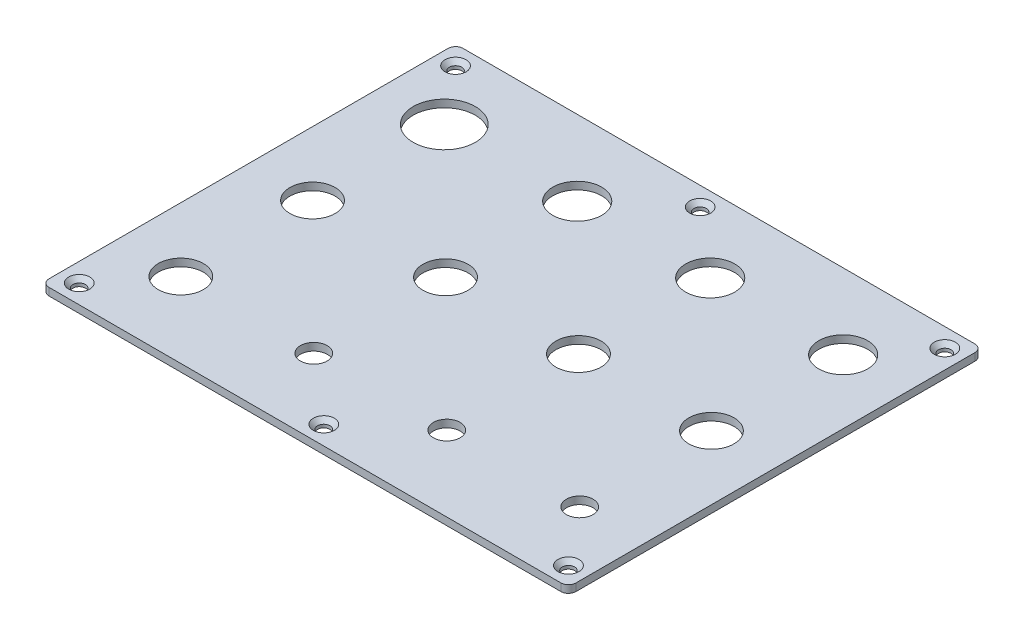
from build123d import *

# Parameters (mm, degrees)
BOTTOM_PLATE_W                       = 140
BOTTOM_PLATE_H                       = 110
BOTTOM_PLATE_EXT_DEPTH               = 2
MIDDLE_ROW_R                         = 6
MIDDLE_ROW_CUT_DEPTH                 = 179.056170912
TOP_ROW_R                            = 8.25
TOP_ROW_R_2                          = 6.5
TOP_ROW_CUT_DEPTH                    = 179.056170912
BOTTOM_ROW_R                         = 3.55
BOTTOM_ROW_R_2                       = 6
BOTTOM_ROW_CUT_DEPTH                 = 179.056170912
PLATE_SCREWS_R                       = 1.65
PLATE_SCREWS_CUT_DEPTH               = 179.056170912
PLATE_SCREW_HEAD_R                   = 2.8
PLATE_SCREW_HEAD_CUT_DEPTH           = 2
PLATE_SCREW_HEAD_CUT_DRAFT           = -45
PLATE_SCREW_HEAD_CUT_PROFILE_2_DEPTH = 2
PLATE_SCREW_HEAD_CUT_PROFILE_2_DRAFT = -45
PLATE_SCREW_HEAD_CUT_PROFILE_3_DEPTH = 2
PLATE_SCREW_HEAD_CUT_PROFILE_3_DRAFT = -45
PLATE_SCREW_HEAD_CUT_PROFILE_4_DEPTH = 2
PLATE_SCREW_HEAD_CUT_PROFILE_4_DRAFT = -45
PLATE_SCREW_HEAD_CUT_PROFILE_5_DEPTH = 2
PLATE_SCREW_HEAD_CUT_PROFILE_5_DRAFT = -45
PLATE_SCREW_HEAD_CUT_PROFILE_6_DEPTH = 2
PLATE_SCREW_HEAD_CUT_PROFILE_6_DRAFT = -45
FILLET1_R                            = 2
FILLET2_R                            = 2
FILLET3_R                            = 2
FILLET4_R                            = 2


with BuildPart() as part:
    # Bottom Plate → Bottom Plate EXT (new body)
    with BuildSketch(Plane(origin=(0, 0, 0), x_dir=(1, 0, 0), z_dir=(0, 1, 0))):
        with Locations((-70, 55)):
            Rectangle(BOTTOM_PLATE_W, BOTTOM_PLATE_H)
    extrude(amount=BOTTOM_PLATE_EXT_DEPTH)

    # Middle Row → Middle Row Cut (cut, through all)
    with BuildSketch(Plane(origin=(0, 2, 0), x_dir=(1, 0, 0), z_dir=(0, 1, 0))):
        with Locations((-123, 55)):
            Circle(MIDDLE_ROW_R)
        with Locations((-87.666666667, 55)):
            Circle(MIDDLE_ROW_R)
        with Locations((-52.333333333, 55)):
            Circle(MIDDLE_ROW_R)
        with Locations((-17, 55)):
            Circle(MIDDLE_ROW_R)
    extrude(amount=-MIDDLE_ROW_CUT_DEPTH, mode=Mode.SUBTRACT)

    # Top Row → Top Row Cut (cut, through all)
    with BuildSketch(Plane(origin=(0, 2, 0), x_dir=(1, 0, 0), z_dir=(0, 1, 0))):
        with Locations((-123, 90)):
            Circle(TOP_ROW_R)
        with Locations((-87.666666667, 90)):
            Circle(TOP_ROW_R_2)
        with Locations((-52.333333333, 90)):
            Circle(TOP_ROW_R_2)
        with Locations((-17, 90)):
            Circle(TOP_ROW_R_2)
    extrude(amount=-TOP_ROW_CUT_DEPTH, mode=Mode.SUBTRACT)

    # Bottom Row → Bottom Row Cut (cut, through all)
    with BuildSketch(Plane(origin=(0, 2, 0), x_dir=(1, 0, 0), z_dir=(0, 1, 0))):
        with Locations((-87.666666667, 20)):
            Circle(BOTTOM_ROW_R)
        with Locations((-52.333333333, 20)):
            Circle(BOTTOM_ROW_R)
        with Locations((-17, 20)):
            Circle(BOTTOM_ROW_R)
        with Locations((-123, 20)):
            Circle(BOTTOM_ROW_R_2)
    extrude(amount=-BOTTOM_ROW_CUT_DEPTH, mode=Mode.SUBTRACT)

    # Plate Screws → Plate Screws Cut (cut, through all)
    with BuildSketch(Plane(origin=(0, 2, 0), x_dir=(1, 0, 0), z_dir=(0, 1, 0))):
        with Locations((-135, 105)):
            Circle(PLATE_SCREWS_R)
        with Locations((-5, 105)):
            Circle(PLATE_SCREWS_R)
        with Locations((-5, 5)):
            Circle(PLATE_SCREWS_R)
        with Locations((-135, 5)):
            Circle(PLATE_SCREWS_R)
        with Locations((-70, 105)):
            Circle(PLATE_SCREWS_R)
        with Locations((-70, 5)):
            Circle(PLATE_SCREWS_R)
    extrude(amount=-PLATE_SCREWS_CUT_DEPTH, mode=Mode.SUBTRACT)


with BuildPart() as plate_screw_head_cut_tool:
    # Plate Screw Head → Plate Screw Head Cut (with draft: the straight prism first)
    with BuildSketch(Plane(origin=(0, 2, 0), x_dir=(1, 0, 0), z_dir=(0, 1, 0))):
        with Locations((-135, 105)):
            Circle(PLATE_SCREW_HEAD_R)
    extrude(amount=-PLATE_SCREW_HEAD_CUT_DEPTH)
    # Plate Screw Head Cut: the draft: its side faces are tilted about the plane it starts from
    plate_screw_head_cut_sides = [plate_screw_head_cut_tool.faces().sort_by_distance(p)[0] for p in [
        (-137.8, 1, -105),
    ]]
    draft(plate_screw_head_cut_sides, Plane(origin=(0, 2, 0), x_dir=(1, 0, 0), z_dir=(0, 1, 0)), PLATE_SCREW_HEAD_CUT_DRAFT)


with BuildPart() as part_1:
    add(part.part)

    # Plate Screw Head Cut: cut by plate_screw_head_cut_tool
    add(plate_screw_head_cut_tool.part, mode=Mode.SUBTRACT)


with BuildPart() as plate_screw_head_cut_profile_2_tool:
    # Plate Screw Head → Plate Screw Head Cut profile 2 (with draft: the straight prism first)
    with BuildSketch(Plane(origin=(0, 2, 0), x_dir=(1, 0, 0), z_dir=(0, 1, 0))):
        with Locations((-5, 105)):
            Circle(PLATE_SCREW_HEAD_R)
    extrude(amount=-PLATE_SCREW_HEAD_CUT_PROFILE_2_DEPTH)
    # Plate Screw Head Cut profile 2: the draft: its side faces are tilted about the plane it starts from
    plate_screw_head_cut_profile_2_sides = [plate_screw_head_cut_profile_2_tool.faces().sort_by_distance(p)[0] for p in [
        (-7.8, 1, -105),
    ]]
    draft(plate_screw_head_cut_profile_2_sides, Plane(origin=(0, 2, 0), x_dir=(1, 0, 0), z_dir=(0, 1, 0)), PLATE_SCREW_HEAD_CUT_PROFILE_2_DRAFT)


with BuildPart() as part_2:
    add(part_1.part)

    # Plate Screw Head Cut profile 2: cut by plate_screw_head_cut_profile_2_tool
    add(plate_screw_head_cut_profile_2_tool.part, mode=Mode.SUBTRACT)


with BuildPart() as plate_screw_head_cut_profile_3_tool:
    # Plate Screw Head → Plate Screw Head Cut profile 3 (with draft: the straight prism first)
    with BuildSketch(Plane(origin=(0, 2, 0), x_dir=(1, 0, 0), z_dir=(0, 1, 0))):
        with Locations((-5, 5)):
            Circle(PLATE_SCREW_HEAD_R)
    extrude(amount=-PLATE_SCREW_HEAD_CUT_PROFILE_3_DEPTH)
    # Plate Screw Head Cut profile 3: the draft: its side faces are tilted about the plane it starts from
    plate_screw_head_cut_profile_3_sides = [plate_screw_head_cut_profile_3_tool.faces().sort_by_distance(p)[0] for p in [
        (-7.8, 1, -5),
    ]]
    draft(plate_screw_head_cut_profile_3_sides, Plane(origin=(0, 2, 0), x_dir=(1, 0, 0), z_dir=(0, 1, 0)), PLATE_SCREW_HEAD_CUT_PROFILE_3_DRAFT)


with BuildPart() as part_3:
    add(part_2.part)

    # Plate Screw Head Cut profile 3: cut by plate_screw_head_cut_profile_3_tool
    add(plate_screw_head_cut_profile_3_tool.part, mode=Mode.SUBTRACT)


with BuildPart() as plate_screw_head_cut_profile_4_tool:
    # Plate Screw Head → Plate Screw Head Cut profile 4 (with draft: the straight prism first)
    with BuildSketch(Plane(origin=(0, 2, 0), x_dir=(1, 0, 0), z_dir=(0, 1, 0))):
        with Locations((-135, 5)):
            Circle(PLATE_SCREW_HEAD_R)
    extrude(amount=-PLATE_SCREW_HEAD_CUT_PROFILE_4_DEPTH)
    # Plate Screw Head Cut profile 4: the draft: its side faces are tilted about the plane it starts from
    plate_screw_head_cut_profile_4_sides = [plate_screw_head_cut_profile_4_tool.faces().sort_by_distance(p)[0] for p in [
        (-137.8, 1, -5),
    ]]
    draft(plate_screw_head_cut_profile_4_sides, Plane(origin=(0, 2, 0), x_dir=(1, 0, 0), z_dir=(0, 1, 0)), PLATE_SCREW_HEAD_CUT_PROFILE_4_DRAFT)


with BuildPart() as part_4:
    add(part_3.part)

    # Plate Screw Head Cut profile 4: cut by plate_screw_head_cut_profile_4_tool
    add(plate_screw_head_cut_profile_4_tool.part, mode=Mode.SUBTRACT)


with BuildPart() as plate_screw_head_cut_profile_5_tool:
    # Plate Screw Head → Plate Screw Head Cut profile 5 (with draft: the straight prism first)
    with BuildSketch(Plane(origin=(0, 2, 0), x_dir=(1, 0, 0), z_dir=(0, 1, 0))):
        with Locations((-70, 105)):
            Circle(PLATE_SCREW_HEAD_R)
    extrude(amount=-PLATE_SCREW_HEAD_CUT_PROFILE_5_DEPTH)
    # Plate Screw Head Cut profile 5: the draft: its side faces are tilted about the plane it starts from
    plate_screw_head_cut_profile_5_sides = [plate_screw_head_cut_profile_5_tool.faces().sort_by_distance(p)[0] for p in [
        (-72.8, 1, -105),
    ]]
    draft(plate_screw_head_cut_profile_5_sides, Plane(origin=(0, 2, 0), x_dir=(1, 0, 0), z_dir=(0, 1, 0)), PLATE_SCREW_HEAD_CUT_PROFILE_5_DRAFT)


with BuildPart() as part_5:
    add(part_4.part)

    # Plate Screw Head Cut profile 5: cut by plate_screw_head_cut_profile_5_tool
    add(plate_screw_head_cut_profile_5_tool.part, mode=Mode.SUBTRACT)


with BuildPart() as plate_screw_head_cut_profile_6_tool:
    # Plate Screw Head → Plate Screw Head Cut profile 6 (with draft: the straight prism first)
    with BuildSketch(Plane(origin=(0, 2, 0), x_dir=(1, 0, 0), z_dir=(0, 1, 0))):
        with Locations((-70, 5)):
            Circle(PLATE_SCREW_HEAD_R)
    extrude(amount=-PLATE_SCREW_HEAD_CUT_PROFILE_6_DEPTH)
    # Plate Screw Head Cut profile 6: the draft: its side faces are tilted about the plane it starts from
    plate_screw_head_cut_profile_6_sides = [plate_screw_head_cut_profile_6_tool.faces().sort_by_distance(p)[0] for p in [
        (-72.8, 1, -5),
    ]]
    draft(plate_screw_head_cut_profile_6_sides, Plane(origin=(0, 2, 0), x_dir=(1, 0, 0), z_dir=(0, 1, 0)), PLATE_SCREW_HEAD_CUT_PROFILE_6_DRAFT)


with BuildPart() as part_6:
    add(part_5.part)

    # Plate Screw Head Cut profile 6: cut by plate_screw_head_cut_profile_6_tool
    add(plate_screw_head_cut_profile_6_tool.part, mode=Mode.SUBTRACT)

    # Fillet1
    fillet1_edges = [part_6.edges().sort_by_distance(p)[0] for p in [
        (-140, 1, -110),
    ]]
    fillet(fillet1_edges, radius=FILLET1_R)

    # Fillet2
    fillet2_edges = [part_6.edges().sort_by_distance(p)[0] for p in [
        (0, 1, -110),
    ]]
    fillet(fillet2_edges, radius=FILLET2_R)

    # Fillet3
    fillet3_edges = [part_6.edges().sort_by_distance(p)[0] for p in [
        (0, 1, 0),
    ]]
    fillet(fillet3_edges, radius=FILLET3_R)

    # Fillet4
    fillet4_edges = [part_6.edges().sort_by_distance(p)[0] for p in [
        (-140, 1, 0),
    ]]
    fillet(fillet4_edges, radius=FILLET4_R)


solid = part_6.part
